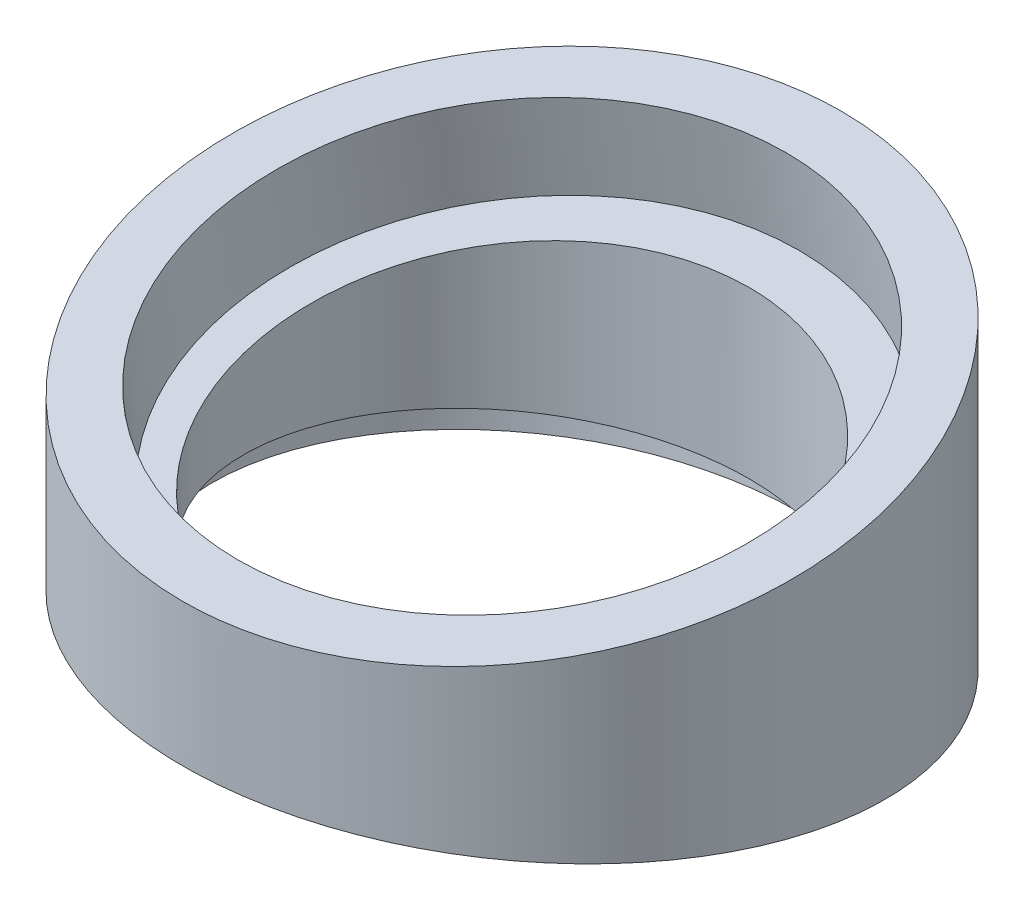
from build123d import *

# Parameters (mm, degrees)
SKETCH_1_R          = 25
EXTRUDE_1_DEPTH     = 30
CUT_EXTRUDE_1_DEPTH = 31.5
SKETCH_7_R          = 21
CUT_EXTRUDE_2_DEPTH = 7
SKETCH_8_R          = 21
CUT_EXTRUDE_3_DEPTH = 3.5
SKETCH_9_R          = 18
CUT_EXTRUDE_4_DEPTH = 107.5


with BuildPart() as part:
    # 草图1 → 凸台-拉伸1 (new body)
    with BuildSketch(Plane(origin=(0, 0, 0), x_dir=(1, 0, 0), z_dir=(0, 1, 0))):
        Circle(SKETCH_1_R)
    extrude(amount=EXTRUDE_1_DEPTH)

    # 草图3 → 切除-拉伸1 (cut, symmetric)
    with BuildSketch(Plane(origin=(0, 0, 0), x_dir=(0, 0, -1), z_dir=(1, 0, 0))):
        Polygon((-25, 18), (25, 25.188898505), (25, 39.510034579), (-25, 39.510034579), align=None)
        Polygon((25, 0), (-25, 7.188898505), (-25, -17.358468242), (25, -17.358468242), align=None)
    extrude(amount=CUT_EXTRUDE_1_DEPTH, both=True, mode=Mode.SUBTRACT)

    # 草图7 → 切除-拉伸2 (cut)
    with BuildSketch(Plane(origin=(0, 21.15708772, 3.041923126), x_dir=(1, 0, 0), z_dir=(0, 0.9898214870420192, 0.14231452417067603))):
        with Locations((0, 3.07320377)):
            Circle(SKETCH_7_R)
    extrude(amount=-CUT_EXTRUDE_2_DEPTH, mode=Mode.SUBTRACT)

    # 草图8 → 切除-拉伸3 (cut)
    with BuildSketch(Plane(origin=(0, 3.521649349, -0.506335595), x_dir=(-1, 0, 0), z_dir=(0, -0.9898214870420203, 0.14231452417066812))):
        with Locations((0, 0.488457665)):
            Circle(SKETCH_8_R)
    extrude(amount=-CUT_EXTRUDE_3_DEPTH, mode=Mode.SUBTRACT)

    # 草图9 → 切除-拉伸4 (cut)
    with BuildSketch(Plane(origin=(0, 0, 0), x_dir=(1, 0, 0), z_dir=(0, 1, 0))):
        Circle(SKETCH_9_R)
    extrude(amount=CUT_EXTRUDE_4_DEPTH, mode=Mode.SUBTRACT)


solid = part.part
